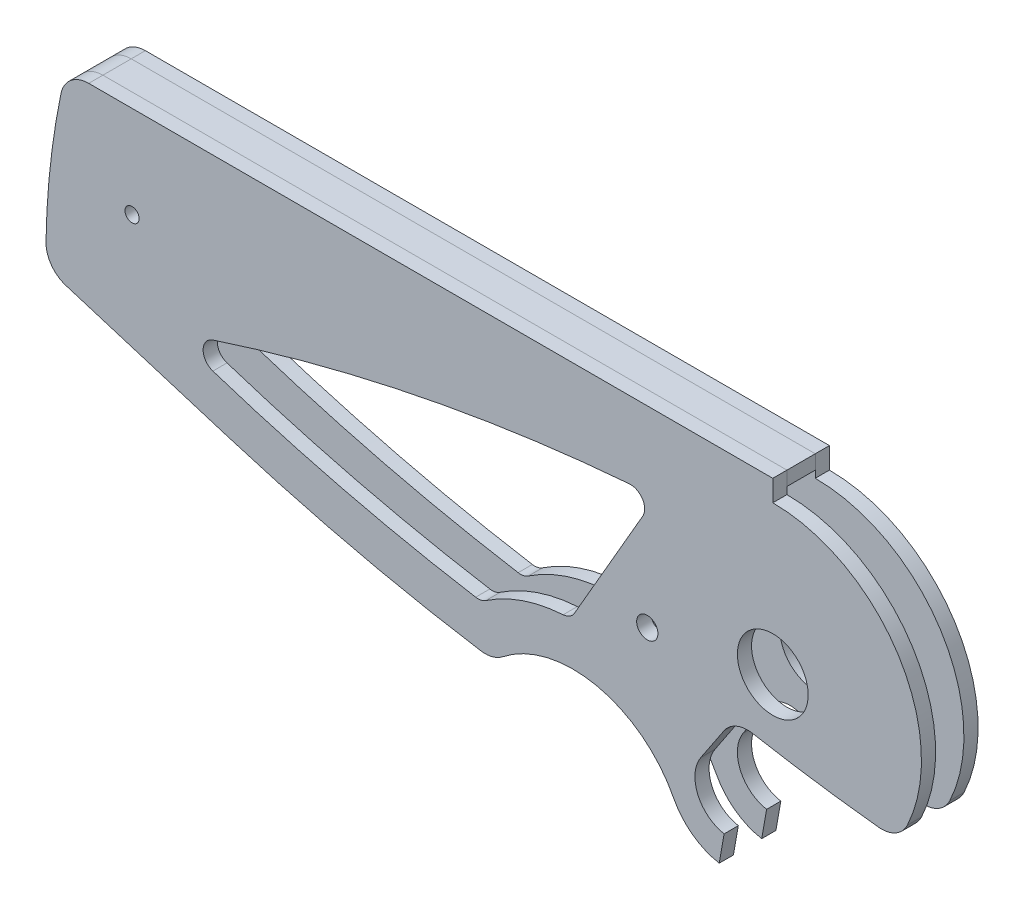
from build123d import *

# Parameters (mm, degrees)
SKICA1_R                 = 2.5
P_IDAT_VYSUNUT_M1_DEPTH  = 1
ODEBRAT_VYSUNUT_M3_DEPTH = 54.092505601
SKICA2_R                 = 0.75
SKICA2_R_2               = 0.5
ODEBRAT_VYSUNUT_M2_DEPTH = 54.092505601
P_IDAT_VYSUNUT_M2_DEPTH  = 1


with BuildPart() as part:
    # Skica1 → Přidat vysunutím1 (new body)
    with BuildSketch(Plane.XY.offset(1)):
        with BuildLine():
            Line((-3.451850397, -5.17306034), (-5.079542319, -7.612374783))
            ThreePointArc((-5.079542319, -7.612374783), (-5.298818394, -9.982565006), (-3.434120444, -11.462019383))
            Line((-3.434120444, -11.462019383), (-3.7814168, -13.431634889))
            ThreePointArc((-3.7814168, -13.431634889), (-5.668297006, -12.623560554), (-7, -11.061552813))
            ThreePointArc((-7, -11.061552813), (-12.421451418, -6.907005546), (-19.074569669, -8.452455647))
            ThreePointArc((-19.074569669, -8.452455647), (-19.810429728, -8.819128255), (-20.631627839, -8.858782909))
            ThreePointArc((-20.631627839, -8.858782909), (-29.612816832, -7.095755552), (-38.448343472, -4.707557447))
            Line((-38.448343472, -4.707557447), (-49.915705076, -1.172077587))
            ThreePointArc((-49.915705076, -1.172077587), (-50.944425281, -0.436513563), (-51.326233925, 0.769115673))
            ThreePointArc((-51.326233925, 0.769115673), (-51.024263074, 5.612344033), (-50.266302206, 10.405416394))
            ThreePointArc((-50.266302206, 10.405416394), (-49.570592062, 11.550940487), (-48.307823831, 12))
            Line((-48.307823831, 12), (0, 12))
            Line((0, 12), (0, 10.5))
            ThreePointArc((0, 10.5), (8.864205709, 5.628130874), (9.502649492, -4.466503402))
            ThreePointArc((9.502649492, -4.466503402), (8.672376262, -5.35932327), (7.478006155, -5.604192624))
            ThreePointArc((7.478006155, -5.604192624), (3.01210543, -5.04033823), (-1.430493256, -4.315412042))
            ThreePointArc((-1.430493256, -4.315412042), (-2.569395622, -4.442030631), (-3.451850397, -5.17306034))
        make_face()
        Circle(SKICA1_R, mode=Mode.SUBTRACT)
    extrude(amount=P_IDAT_VYSUNUT_M1_DEPTH)

    # Skica14 → Odebrat vysunutím3 (cut, through all)
    with BuildSketch(Plane.XY):
        with BuildLine():
            Line((-14.000954762, -3.250365002), (-9.180543984, 5.098831378))
            ThreePointArc((-9.180543984, 5.098831378), (-9.201183144, 6.132986878), (-10.126304066, 6.5956475))
            ThreePointArc((-10.126304066, 6.5956475), (-25.0093231, 4.513187085), (-39.5421575, 0.687272652))
            ThreePointArc((-39.5421575, 0.687272652), (-40.23080172, -0.263668209), (-39.540926846, -1.21371665))
            ThreePointArc((-39.540926846, -1.21371665), (-30.346748023, -3.835878825), (-20.981929874, -5.761713644))
            ThreePointArc((-20.981929874, -5.761713644), (-20.60514794, -5.752569661), (-20.258511168, -5.604612957))
            ThreePointArc((-20.258511168, -5.604612957), (-17.654944999, -4.313023149), (-14.803991078, -3.748379218))
            ThreePointArc((-14.803991078, -3.748379218), (-14.339939825, -3.600205269), (-14.000954762, -3.250365002))
        make_face()
    extrude(amount=ODEBRAT_VYSUNUT_M3_DEPTH, mode=Mode.SUBTRACT)

    # Skica2 → Odebrat vysunutím2 (cut, through all)
    with BuildSketch(Plane.XY):
        with Locations((-8.863269777, -1.562833599)):
            Circle(SKICA2_R)
        with Locations((-45.246630015, 5.5)):
            Circle(SKICA2_R_2)
    extrude(amount=ODEBRAT_VYSUNUT_M2_DEPTH, mode=Mode.SUBTRACT)


with BuildPart() as body_2:
    # Skica16 → Přidat vysunutím2 (new, symmetric)
    with BuildSketch(Plane(origin=(0, 0, 0), x_dir=(-1, 0, 0), z_dir=(0, 0, -1))):
        with BuildLine():
            Line((0, 12), (48.307823831, 12))
            ThreePointArc((48.307823831, 12), (49.570592062, 11.550940487), (50.266302206, 10.405416394))
            ThreePointArc((50.266302206, 10.405416394), (51.024263074, 5.612344033), (51.326233925, 0.769115673))
            ThreePointArc((51.326233925, 0.769115673), (51.324464931, 0.649874315), (51.31559221, 0.530950366))
            ThreePointArc((51.31559221, 0.530950366), (26.186308465, 8.356056534), (0, 11))
            Line((0, 11), (0, 12))
        make_face()
    extrude(amount=P_IDAT_VYSUNUT_M2_DEPTH, both=True)


with BuildPart() as body_3:
    # Zrcadlit1: mirrored copy
    add(part.part.mirror(Plane.XY))


solid = Compound([part.part, body_2.part, body_3.part])
